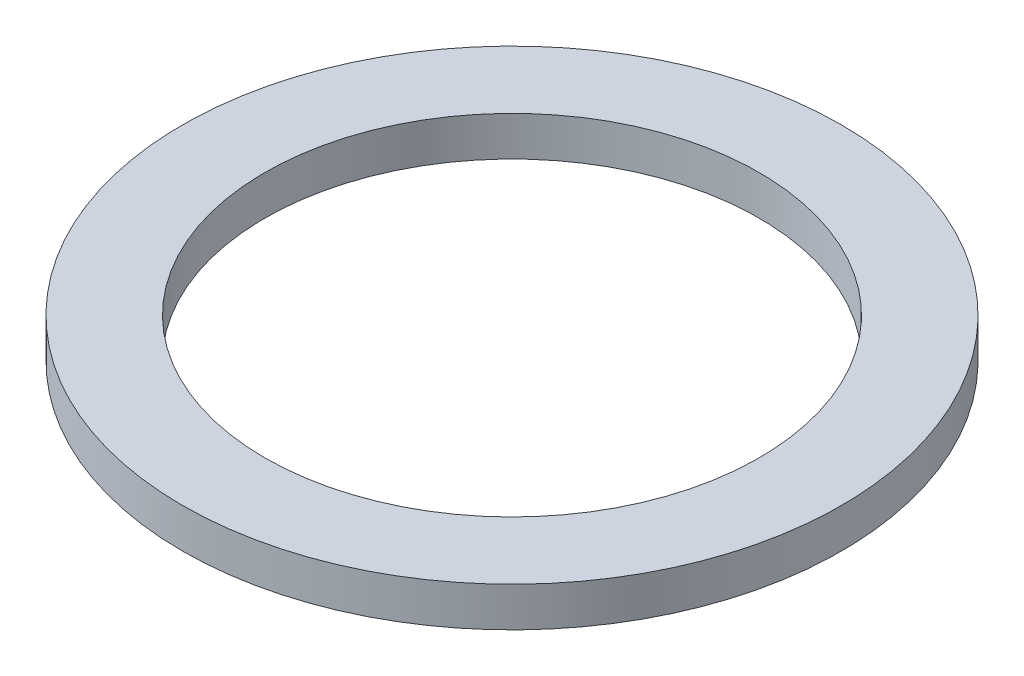
from build123d import *

# Parameters (mm, degrees)
SKETCH1_R           = 10
SKETCH1_R_2         = 7.5
BOSS_EXTRUDE1_DEPTH = 1.2


with BuildPart() as part:
    # Sketch1 → Boss-Extrude1 (new body)
    with BuildSketch(Plane(origin=(0, 0, 0), x_dir=(1, 0, 0), z_dir=(0, 1, 0))):
        Circle(SKETCH1_R)
        Circle(SKETCH1_R_2, mode=Mode.SUBTRACT)
    extrude(amount=BOSS_EXTRUDE1_DEPTH)


solid = part.part
